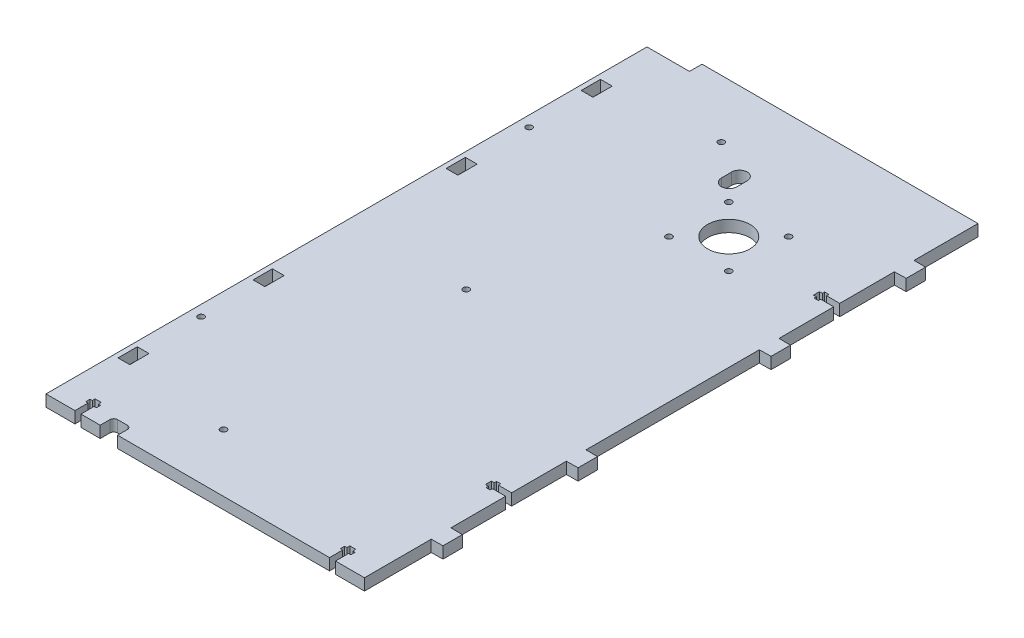
from build123d import *

# Parameters (mm, degrees)
SKETCH_1_R      = 1.6
SKETCH_1_R_2    = 11
SKETCH_1_W      = 6.1
SKETCH_1_H      = 10
EXTRUDE_1_DEPTH = 6


with BuildPart() as part:
    # Эскиз1 → Бобышка-Вытянуть1 (new body)
    with BuildSketch(Plane(origin=(0, 0, 6), x_dir=(1, 0, 0), z_dir=(0, 1, 0))):
        with BuildLine():
            Line((933.155518961, 517.721066), (933.155518961, 552.32339))
            Line((933.155518961, 552.32339), (939.155518961, 552.42339))
            Line((939.155518961, 552.42339), (939.155518961, 562.42339))
            Line((939.155518961, 562.42339), (933.155518961, 562.52339))
            Line((933.155518961, 562.52339), (933.155518961, 590.87339))
            Line((933.155518961, 590.87339), (926.355518961, 590.87339))
            Line((926.355518961, 590.87339), (926.355518961, 589.67339))
            Line((926.355518961, 589.67339), (924.155518961, 589.67339))
            Line((924.155518961, 589.67339), (924.155518961, 590.87339))
            Line((924.155518961, 590.87339), (922.655518961, 590.87339))
            Line((922.655518961, 590.87339), (922.655518961, 593.97339))
            Line((922.655518961, 593.97339), (924.155518961, 593.97339))
            Line((924.155518961, 593.97339), (924.155518961, 595.17339))
            Line((924.155518961, 595.17339), (926.355518961, 595.17339))
            Line((926.355518961, 595.17339), (926.355518961, 593.97339))
            Line((926.355518961, 593.97339), (933.155518961, 593.97339))
            Line((933.155518961, 593.97339), (933.155518961, 622.32339))
            Line((933.155518961, 622.32339), (939.155518961, 622.42339))
            Line((939.155518961, 622.42339), (939.155518961, 632.42339))
            Line((939.155518961, 632.42339), (933.155518961, 632.52339))
            Line((933.155518961, 632.52339), (933.155518961, 722.32339))
            Line((933.155518961, 722.32339), (939.155518961, 722.42339))
            Line((939.155518961, 722.42339), (939.155518961, 732.42339))
            Line((939.155518961, 732.42339), (933.155518961, 732.52339))
            Line((933.155518961, 732.52339), (933.155518961, 760.87339))
            Line((933.155518961, 760.87339), (926.355518961, 760.87339))
            Line((926.355518961, 760.87339), (926.355518961, 759.67339))
            Line((926.355518961, 759.67339), (924.155518961, 759.67339))
            Line((924.155518961, 759.67339), (924.155518961, 760.87339))
            Line((924.155518961, 760.87339), (922.655518961, 760.87339))
            Line((922.655518961, 760.87339), (922.655518961, 763.97339))
            Line((922.655518961, 763.97339), (924.155518961, 763.97339))
            Line((924.155518961, 763.97339), (924.155518961, 765.17339))
            Line((924.155518961, 765.17339), (926.355518961, 765.17339))
            Line((926.355518961, 765.17339), (926.355518961, 763.97339))
            Line((926.355518961, 763.97339), (933.155518961, 763.97339))
            Line((933.155518961, 763.97339), (933.155518961, 792.32339))
            Line((933.155518961, 792.32339), (939.155518961, 792.42339))
            Line((939.155518961, 792.42339), (939.155518961, 802.42339))
            Line((939.155518961, 802.42339), (933.155518961, 802.52339))
            Line((933.155518961, 802.52339), (933.155518961, 835.62339))
            Line((933.155518961, 835.62339), (833.155518961, 835.62339))
            Line((833.155518961, 835.62339), (790.155518961, 835.62339))
            Line((790.155518961, 835.62339), (790.155518961, 829.12339))
            Line((790.155518961, 829.12339), (768.155518961, 829.12339))
            Line((768.155518961, 829.12339), (768.155518961, 517.721066))
            Line((768.155518961, 517.721066), (783.155518961, 517.721066))
            Line((783.155518961, 517.721066), (783.155518961, 524.521066))
            Line((783.155518961, 524.521066), (781.955518961, 524.521066))
            Line((781.955518961, 524.521066), (781.955518961, 526.721066))
            Line((781.955518961, 526.721066), (783.155518961, 526.721066))
            Line((783.155518961, 526.721066), (783.155518961, 528.221066))
            Line((783.155518961, 528.221066), (786.255518961, 528.221066))
            Line((786.255518961, 528.221066), (786.255518961, 526.721066))
            Line((786.255518961, 526.721066), (787.455518961, 526.721066))
            Line((787.455518961, 526.721066), (787.455518961, 524.521066))
            Line((787.455518961, 524.521066), (786.255518961, 524.521066))
            Line((786.255518961, 524.521066), (786.255518961, 517.721066))
            Line((786.255518961, 517.721066), (796.255518961, 517.721066))
            Line((796.255518961, 517.721066), (796.255518961, 522.721066))
            ThreePointArc((796.255518961, 522.721066), (796.841305399, 524.135279562), (798.255518961, 524.721066))
            Line((798.255518961, 524.721066), (803.255518961, 524.721066))
            ThreePointArc((803.255518961, 524.721066), (804.669732523, 524.135279562), (805.255518961, 522.721066))
            Line((805.255518961, 522.721066), (805.255518961, 517.721066))
            Line((805.255518961, 517.721066), (833.155518961, 517.721066))
            Line((833.155518961, 517.721066), (915.055518961, 517.721066))
            Line((915.055518961, 517.721066), (915.055518961, 524.521066))
            Line((915.055518961, 524.521066), (913.855518961, 524.521066))
            Line((913.855518961, 524.521066), (913.855518961, 526.721066))
            Line((913.855518961, 526.721066), (915.055518961, 526.721066))
            Line((915.055518961, 526.721066), (915.055518961, 528.221066))
            Line((915.055518961, 528.221066), (918.155518961, 528.221066))
            Line((918.155518961, 528.221066), (918.155518961, 526.721066))
            Line((918.155518961, 526.721066), (919.355518961, 526.721066))
            Line((919.355518961, 526.721066), (919.355518961, 524.521066))
            Line((919.355518961, 524.521066), (918.155518961, 524.521066))
            Line((918.155518961, 524.521066), (918.155518961, 517.721066))
            Line((918.155518961, 517.721066), (933.155518961, 517.721066))
        make_face()
        with Locations((830.155518961, 805.62339)):
            Circle(SKETCH_1_R, mode=Mode.SUBTRACT)
        with Locations((830.155518961, 673.422228)):
            Circle(SKETCH_1_R, mode=Mode.SUBTRACT)
        with Locations((830.155518961, 547.721066)):
            Circle(SKETCH_1_R, mode=Mode.SUBTRACT)
        with Locations((858.975174848, 780.67339)):
            Circle(SKETCH_1_R, mode=Mode.SUBTRACT)
        with Locations((773.705518961, 592.52339)):
            Circle(SKETCH_1_R, mode=Mode.SUBTRACT)
        with Locations((773.705518961, 762.52339)):
            Circle(SKETCH_1_R, mode=Mode.SUBTRACT)
        with Locations((858.975174848, 749.67339)):
            Circle(SKETCH_1_R, mode=Mode.SUBTRACT)
        with Locations((874.475174848, 765.17339)):
            Circle(SKETCH_1_R_2, mode=Mode.SUBTRACT)
        with Locations((889.975174848, 749.67339)):
            Circle(SKETCH_1_R, mode=Mode.SUBTRACT)
        with Locations((889.975174848, 780.67339)):
            Circle(SKETCH_1_R, mode=Mode.SUBTRACT)
        with BuildLine():
            Line((846.224740954, 794.949801376), (846.224740954, 789.666860897))
            ThreePointArc((846.224740954, 789.666860897), (850.224740954, 785.666860897), (854.224740954, 789.666860897))
            Line((854.224740954, 789.666860897), (854.224740954, 794.949801376))
            ThreePointArc((854.224740954, 794.949801376), (850.224740954, 798.949801376), (846.224740954, 794.949801376))
        make_face(mode=Mode.SUBTRACT)
        with Locations((773.705518961, 557.52339)):
            Rectangle(SKETCH_1_W, SKETCH_1_H, mode=Mode.SUBTRACT)
        with Locations((773.705518961, 627.52339)):
            Rectangle(SKETCH_1_W, SKETCH_1_H, mode=Mode.SUBTRACT)
        with Locations((773.705518961, 727.52339)):
            Rectangle(SKETCH_1_W, SKETCH_1_H, mode=Mode.SUBTRACT)
        with Locations((773.705518961, 797.52339)):
            Rectangle(SKETCH_1_W, SKETCH_1_H, mode=Mode.SUBTRACT)
    extrude(amount=-EXTRUDE_1_DEPTH)


solid = part.part
